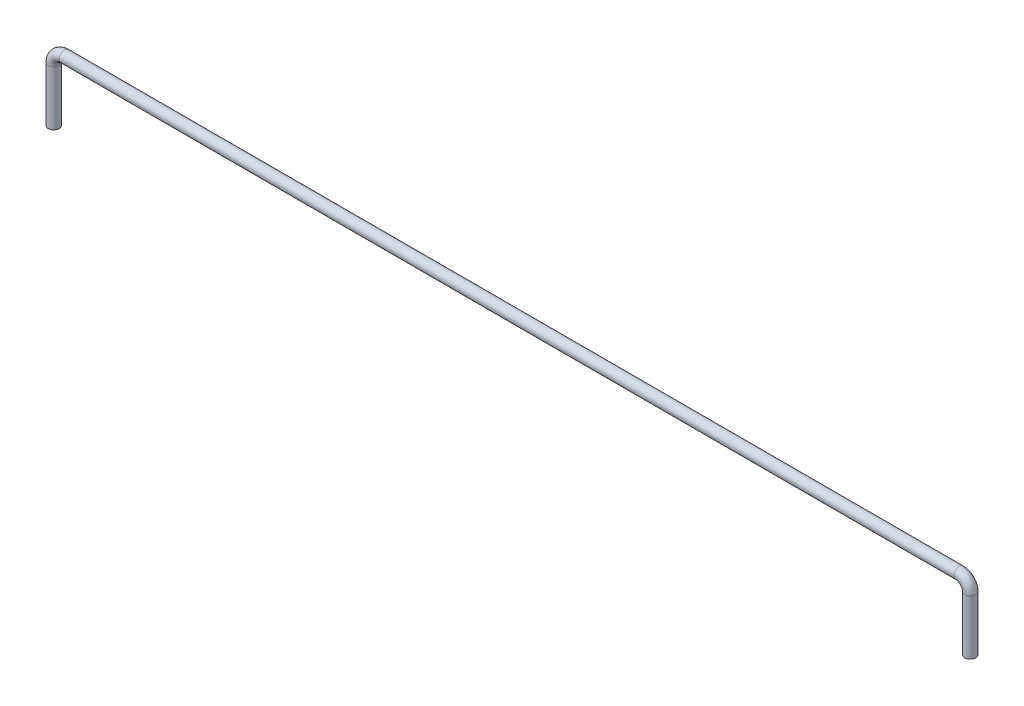
from build123d import *

# Parameters (mm, degrees)
SKETCH1_R           = 0.25
BOSS_EXTRUDE1_DEPTH = 2
SWEEP1_OUTLINE_R    = 0.25
SWEEP1_DEPTH        = 2.5
SWEEP1_2_OUTLINE_R  = 0.25
SWEEP1_2_ANGLE      = 90
SWEEP1_3_OUTLINE_R  = 0.25
SWEEP1_3_ANGLE      = 90
SWEEP1_START        = 0.4999999
SWEEP1_4_OUTLINE_R  = 0.25
SWEEP1_4_DEPTH      = 40.9000002


with BuildPart() as part:
    # Sketch1 → Boss-Extrude1 (new body)
    with BuildSketch(Plane(origin=(0, 0, 0), x_dir=(1, 0, 0), z_dir=(0, 1, 0))):
        with Locations(Location((0, 0, 0), (0, 0, 270))):
            Circle(SKETCH1_R)
    extrude(amount=BOSS_EXTRUDE1_DEPTH)

    # Sweep1: read off the stored shape, not the designer's step
    # Sweep1 outline → Sweep1 (add)
    with BuildSketch(Plane(origin=(0, 0, 0), x_dir=(1, 0, 0), z_dir=(0, 1, 0))):
        Circle(SWEEP1_OUTLINE_R)
        with Locations((41.9, 0)):
            Circle(SWEEP1_OUTLINE_R)
    extrude(amount=SWEEP1_DEPTH)

    # Sweep1 2 outline → Sweep1 2 (revolve)
    with BuildSketch(Plane(origin=(0.5, 2.5, 0), x_dir=(0, 1, 0), z_dir=(1, 0, 0))):
        with Locations((0.5, 0)):
            Circle(SWEEP1_2_OUTLINE_R)
    revolve(axis=Axis((0.5, 2.5, 0), (0, 0, 1)), revolution_arc=SWEEP1_2_ANGLE)

    # Sweep1 3 outline → Sweep1 3 (revolve)
    with BuildSketch(Plane(origin=(41.4, 2.5, 0), x_dir=(1, 0, 0), z_dir=(0, -1, 0))):
        with Locations((0.5, 0)):
            Circle(SWEEP1_3_OUTLINE_R)
    revolve(axis=Axis((41.4, 2.5, 0), (0, 0, 1)), revolution_arc=SWEEP1_3_ANGLE)

    # Sweep1 4 outline → Sweep1 4 (add)
    with BuildSketch(Plane.YZ.offset(SWEEP1_START)):
        with Locations((3, 0)):
            Circle(SWEEP1_4_OUTLINE_R)
    extrude(amount=SWEEP1_4_DEPTH)


solid = part.part
